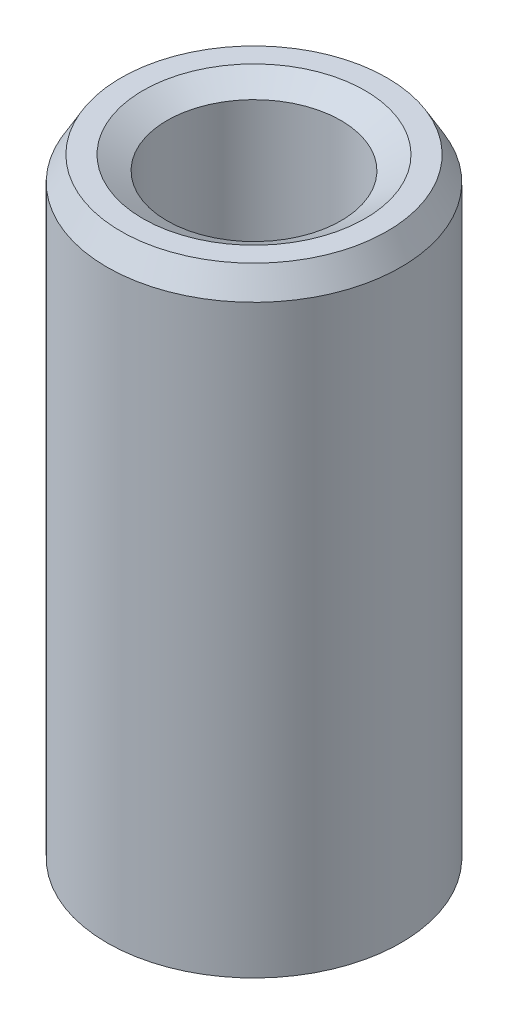
from build123d import *
from OCP.BRepFilletAPI import BRepFilletAPI_MakeChamfer

# Parameters (mm, degrees)
SKETCH1_R           = 17.5
BOSS_EXTRUDE1_DEPTH = 74.211187243
SKETCH2_R           = 10.355995356
CUT_EXTRUDE1_DEPTH  = 79.229152571
CHAMFER1_SIZE       = 2.867983753
CHAMFER1_SIZE2      = 1.655831192


with BuildPart() as part:
    # Sketch1 → Boss-Extrude1 (new body)
    with BuildSketch(Plane(origin=(0, 0, 0), x_dir=(1, 0, 0), z_dir=(0, 1, 0))):
        Circle(SKETCH1_R)
    extrude(amount=BOSS_EXTRUDE1_DEPTH)

    # Sketch2 → Cut-Extrude1 (cut, through all)
    with BuildSketch(Plane(origin=(0, 0, 0), x_dir=(1, 0, 0), z_dir=(0, 1, 0))):
        Circle(SKETCH2_R)
    extrude(amount=CUT_EXTRUDE1_DEPTH, mode=Mode.SUBTRACT)

    # Chamfer1: one chamfer whose edges measure the first distance from different faces: ONE call of the kernel's chamfer builder (chamfer() names one face for all edges)
    chamfer1_edges_1 = [part.edges().sort_by_distance(p)[0] for p in [
        (-10.355995356, 74.211187243, 0),
    ]]
    chamfer1_side_1 = [part.faces().sort_by_distance(p)[0] for p in [
        (-17.005025253, 74.211187243, 0),
    ]]
    chamfer1_edges_2 = [part.edges().sort_by_distance(p)[0] for p in [
        (-10.355995356, 0, 0),
    ]]
    chamfer1_side_2 = [part.faces().sort_by_distance(p)[0] for p in [
        (-10.355995356, 37.105593622, 0),
    ]]
    chamfer1_edges_3 = [part.edges().sort_by_distance(p)[0] for p in [
        (-17.5, 0, 0),
    ]]
    chamfer1_side_3 = [part.faces().sort_by_distance(p)[0] for p in [
        (-17.005025253, 0, 0),
    ]]
    chamfer1_edges_4 = [part.edges().sort_by_distance(p)[0] for p in [
        (-17.5, 74.211187243, 0),
    ]]
    chamfer1_side_4 = [part.faces().sort_by_distance(p)[0] for p in [
        (-17.5, 37.105593622, 0),
    ]]
    chamfer1 = BRepFilletAPI_MakeChamfer(part.part.solid().wrapped)
    for e in chamfer1_edges_1:
        chamfer1.Add(CHAMFER1_SIZE, CHAMFER1_SIZE2, e.wrapped, chamfer1_side_1[0].wrapped)  # the first distance lies on this face
    for e in chamfer1_edges_2:
        chamfer1.Add(CHAMFER1_SIZE, CHAMFER1_SIZE2, e.wrapped, chamfer1_side_2[0].wrapped)  # the first distance lies on this face
    for e in chamfer1_edges_3:
        chamfer1.Add(CHAMFER1_SIZE, CHAMFER1_SIZE2, e.wrapped, chamfer1_side_3[0].wrapped)  # the first distance lies on this face
    for e in chamfer1_edges_4:
        chamfer1.Add(CHAMFER1_SIZE, CHAMFER1_SIZE2, e.wrapped, chamfer1_side_4[0].wrapped)  # the first distance lies on this face
    add(Compound.cast(chamfer1.Shape()), mode=Mode.REPLACE)


solid = part.part
